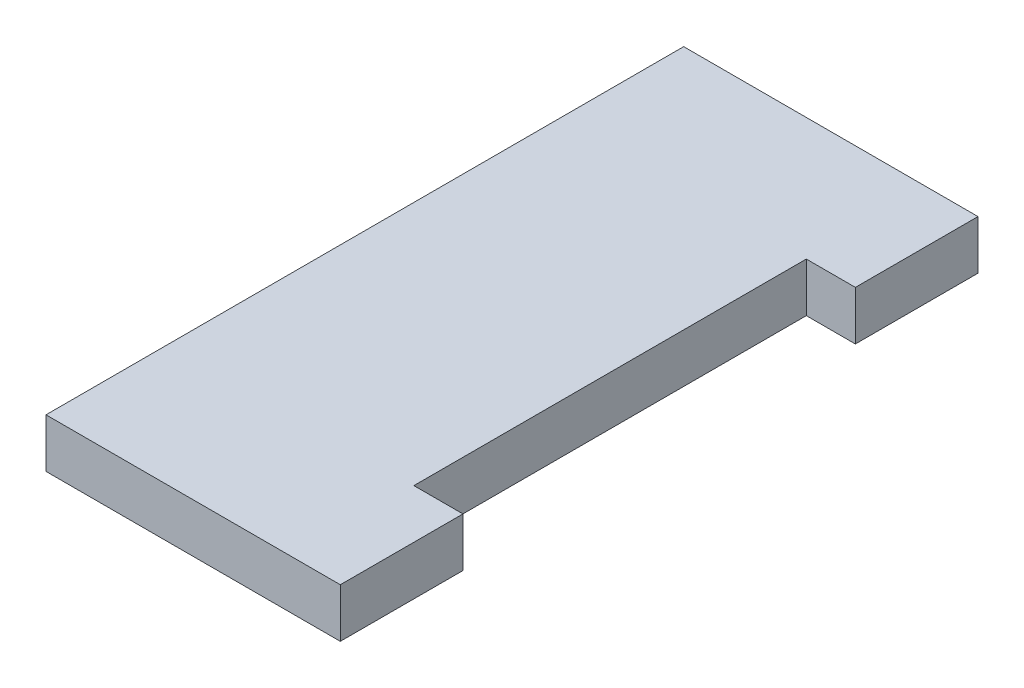
from build123d import *

# Parameters (mm, degrees)
SKIZZE1_W                       = 120
SKIZZE1_H                       = 65
AUFSATZ_LINEAR_AUSTRAGEN1_DEPTH = 5
SKIZZE2_W                       = 5
SKIZZE2_H                       = 40
SCHNITT_LINEAR_AUSTRAGEN1_DEPTH = 137.565002837
SKIZZE3_W                       = 90
SKIZZE3_H                       = 65
SCHNITT_LINEAR_AUSTRAGEN2_DEPTH = 137.565002837


with BuildPart() as part:
    # Skizze1 → Aufsatz-Linear austragen1 (new body)
    with BuildSketch(Plane(origin=(0, 0, 0), x_dir=(1, 0, 0), z_dir=(0, 1, 0))):
        with Locations((60, 32.5)):
            Rectangle(SKIZZE1_W, SKIZZE1_H)
    extrude(amount=AUFSATZ_LINEAR_AUSTRAGEN1_DEPTH)

    # Skizze2 → Schnitt-Linear austragen1 (cut, through all)
    with BuildSketch(Plane(origin=(0, 5, 0), x_dir=(1, 0, 0), z_dir=(0, 1, 0))):
        with Locations((117.5, 32.5)):
            Rectangle(SKIZZE2_W, SKIZZE2_H)
        with Locations((2.5, 32.5)):
            Rectangle(SKIZZE2_W, SKIZZE2_H)
    extrude(amount=-SCHNITT_LINEAR_AUSTRAGEN1_DEPTH, mode=Mode.SUBTRACT)

    # Skizze3 → Schnitt-Linear austragen2 (cut, through all)
    with BuildSketch(Plane(origin=(0, 5, 0), x_dir=(1, 0, 0), z_dir=(0, 1, 0))):
        with Locations((45, 32.5)):
            Rectangle(SKIZZE3_W, SKIZZE3_H)
    extrude(amount=-SCHNITT_LINEAR_AUSTRAGEN2_DEPTH, mode=Mode.SUBTRACT)


solid = part.part
